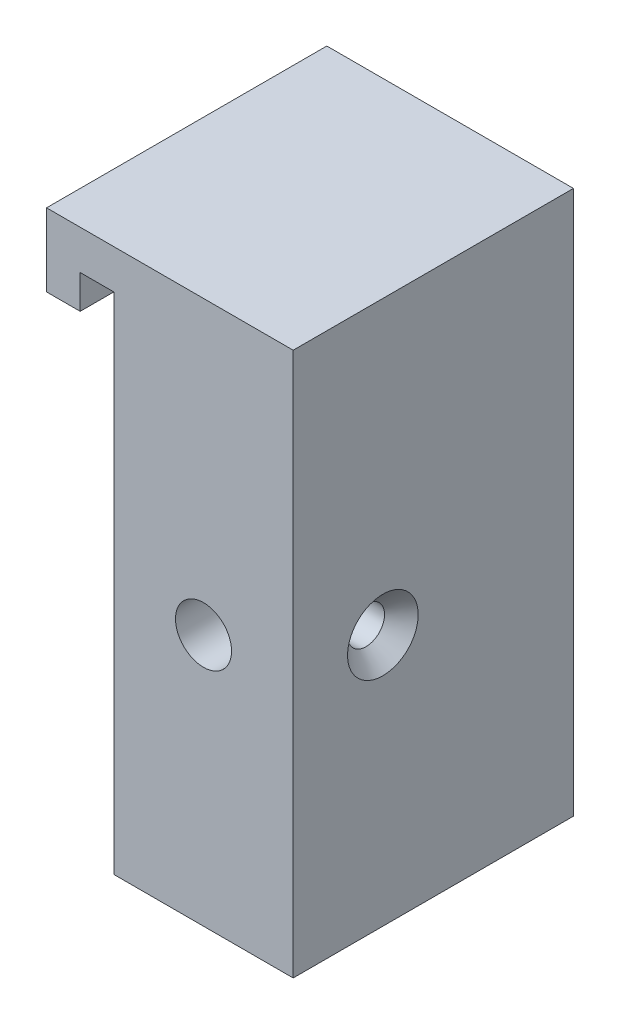
from build123d import *

# Parameters (mm, degrees)
BOSS_EXTRUDE1_DEPTH        = 25
F_10_0MM_DOWEL_HOLE1_D     = 10
F_10_0MM_DOWEL_HOLE1_DEPTH = 25
M8_TAPPED_HOLE1_D          = 6.8
M8_TAPPED_HOLE1_DEPTH      = 15


# Read off the part's stored shape, not the designer's step: CSK for M6 Countersunk Flat Head Screw1
with BuildPart() as part:
    # Sketch1 → Boss-Extrude1 (new, symmetric)
    with BuildSketch(Plane.XY):
        Polygon((0, 0), (0, 97), (-44, 97), (-44, 84), (-38, 84), (-38, 90), (-32, 90), (-32, 0), align=None)
    extrude(amount=BOSS_EXTRUDE1_DEPTH, both=True)

    # Ø10.0mm Dowel Hole1
    with Locations(Plane.XY.offset(25)):
        with Locations((-16, 45)):
            Hole(F_10_0MM_DOWEL_HOLE1_D / 2, depth=F_10_0MM_DOWEL_HOLE1_DEPTH)

    # M8 Tapped Hole1
    with Locations(Plane(origin=(0, 0, 0), x_dir=(-1, 0, 0), z_dir=(0, -1, 0))):
        with Locations((7, 0), (25, 0)):
            Hole(M8_TAPPED_HOLE1_D / 2, depth=M8_TAPPED_HOLE1_DEPTH)

    # CSK for M6 Countersunk Flat Head Scr 2 → CSK for M6 Countersunk Flat Head Screw1 (revolve, cut)
    with BuildSketch(Plane(origin=(0, 45, 9), x_dir=(0, 1, 0), z_dir=(0, 0, -1))):
        Polygon((0, -12.244302381), (3.3, -12.244302381), (3.3, -3), (6.3, 0), (0, 0), align=None)
    revolve(axis=Axis((0, 45, 9), (1, 0, 0)), mode=Mode.SUBTRACT)


solid = part.part
